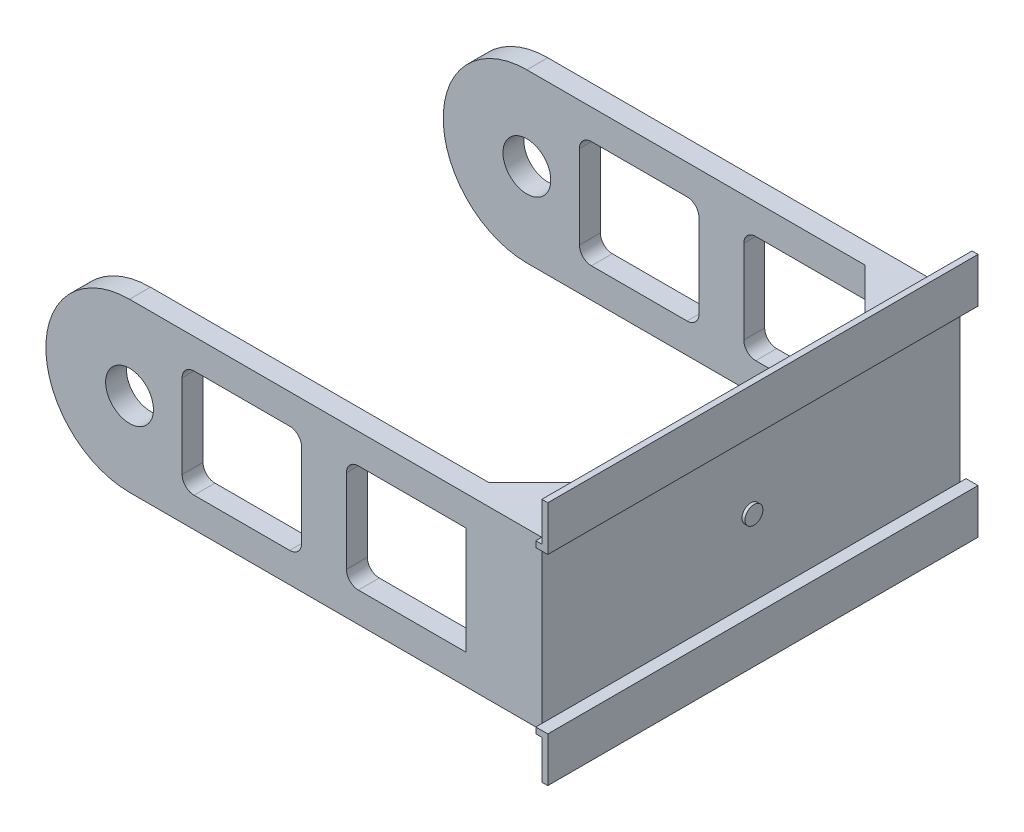
from build123d import *

# Parameters (mm, degrees)
SKETCH1_R           = 4
BOSS_EXTRUDE1_DEPTH = 35
SKETCH3_W           = 44.253465858
SKETCH3_H           = 32.381458222
CUT_EXTRUDE1_DEPTH  = 27.5
SKETCH4_W           = 83.940233782
SKETCH4_H           = 63
CUT_EXTRUDE2_DEPTH  = 68.149087857
CHAMFER1_SIZE       = 10
SKETCH7_W           = 20
SKETCH7_H           = 18
CUT_EXTRUDE3_DEPTH  = 88.155034278
FILLET2_R           = 2
BOSS_EXTRUDE4_START = 1
BOSS_EXTRUDE4_DEPTH = 72
SKETCH11_R          = 1.5
BOSS_EXTRUDE5_DEPTH = 0.5


with BuildPart() as part:
    # Sketch1 → Boss-Extrude1 (new, symmetric)
    with BuildSketch(Plane.XY):
        with BuildLine():
            Line((-36, 14), (33, 14))
            Line((33, 14), (33, -14))
            Line((33, -14), (-36, -14))
            ThreePointArc((-36, -14), (-50, 0), (-36, 14))
        make_face()
        with Locations((-36, 0)):
            Circle(SKETCH1_R, mode=Mode.SUBTRACT)
    extrude(amount=BOSS_EXTRUDE1_DEPTH, both=True)

    # Sketch3 → Cut-Extrude1 (cut, symmetric)
    with BuildSketch(Plane.XY):
        with Locations((-36, 0)):
            Rectangle(SKETCH3_W, SKETCH3_H)
    extrude(amount=CUT_EXTRUDE1_DEPTH, both=True, mode=Mode.SUBTRACT)

    # Sketch4 → Cut-Extrude2 (cut, through all)
    with BuildSketch(Plane(origin=(0, 14, 0), x_dir=(1, 0, 0), z_dir=(0, 1, 0))):
        with Locations((-11.375607931, 0)):
            Rectangle(SKETCH4_W, SKETCH4_H)
    extrude(amount=-CUT_EXTRUDE2_DEPTH, mode=Mode.SUBTRACT)

    # Chamfer1
    chamfer1_edges = [part.edges().sort_by_distance(p)[0] for p in [
        (30.59450896, 0, 31.5),
        (30.59450896, 0, -31.5),
    ]]
    chamfer(chamfer1_edges, length=CHAMFER1_SIZE)

    # Sketch7 → Cut-Extrude3 (cut, through all)
    with BuildSketch(Plane.XY.offset(35)):
        with Locations((-17.198958596, 0)):
            Rectangle(SKETCH7_W, SKETCH7_H)
        with Locations((10.301041404, 0)):
            Rectangle(SKETCH7_W, SKETCH7_H)
    extrude(amount=-CUT_EXTRUDE3_DEPTH, mode=Mode.SUBTRACT)

    # Fillet2
    # the kernel refuses this fillet: 2 mm, written as the material it adds along each edge
    with BuildSketch(Plane(origin=(-27.198958596, -9, -31.5), x_dir=(0, 1, 0), z_dir=(0, 0, -1)), Plane(origin=(-7.198958596, 9, -31.5), x_dir=(0, -1, 0), z_dir=(0, 0, -1)), Plane(origin=(-7.198958596, 9, 35), x_dir=(0, -1, 0), z_dir=(0, 0, -1)), Plane(origin=(-7.198958596, -9, -31.5), x_dir=(-1, 0, 0), z_dir=(0, 0, -1)), Plane(origin=(0.301041404, -9, -31.5), x_dir=(0, 1, 0), z_dir=(0, 0, -1))) as fillet2_piece_1:
        with BuildLine():
            CenterArc((FILLET2_R, FILLET2_R), FILLET2_R, 180, 90)
            Line((0, FILLET2_R), (0, 0))
            Line((0, 0), (FILLET2_R, 0))
        make_face()
    extrude(amount=3.5)
    with BuildSketch(Plane(origin=(-27.198958596, -9, 35), x_dir=(1, 0, 0), z_dir=(0, 0, -1)), Plane(origin=(-27.198958596, 9, -31.5), x_dir=(0, -1, 0), z_dir=(0, 0, -1)), Plane(origin=(-27.198958596, 9, 35), x_dir=(0, -1, 0), z_dir=(0, 0, -1)), Plane(origin=(-7.198958596, -9, 35), x_dir=(0, 1, 0), z_dir=(0, 0, -1)), Plane(origin=(0.301041404, -9, 35), x_dir=(1, 0, 0), z_dir=(0, 0, -1)), Plane(origin=(0.301041404, 9, -31.5), x_dir=(0, -1, 0), z_dir=(0, 0, -1)), Plane(origin=(0.301041404, 9, 35), x_dir=(0, -1, 0), z_dir=(0, 0, -1))) as fillet2_piece_2:
        with BuildLine():
            CenterArc((FILLET2_R, -FILLET2_R), FILLET2_R, 90, 90)
            Line((0, -FILLET2_R), (0, 0))
            Line((0, 0), (FILLET2_R, 0))
        make_face()
    extrude(amount=3.5)
    # the kernel refuses this fillet: 2 mm, written as the material it takes off along each edge
    with BuildSketch(Plane(origin=(20.301041404, 9, -31.5), x_dir=(1, 0, 0), z_dir=(0, -1, 0)), Plane(origin=(20.301041404, -9, 31.5), x_dir=(1, 0, 0), z_dir=(0, 1, 0))) as fillet2_2_piece_1:
        with BuildLine():
            CenterArc((2, -1.042951109), FILLET2_R, 148.568719088, 31.431280912)
            Line((0, -1.042951109), (0, 0))
            Line((0, 0), (0.293467555, 0))
        make_face()
    extrude(amount=18, mode=Mode.SUBTRACT)

    # Sketch10 → Boss-Extrude4 (add)
    with BuildSketch(Plane.XY.offset(35).offset(BOSS_EXTRUDE4_START)):
        Polygon((33, 14), (34, 14), (34, 20.5), (35, 20.5), (35, 13), (33, 13), align=None)
        Polygon((33, -14), (33, -13), (35, -13), (35, -20.5), (34, -20.5), (34, -14), align=None)
    extrude(amount=-BOSS_EXTRUDE4_DEPTH)

    # Sketch11 → Boss-Extrude5 (add)
    with BuildSketch(Plane(origin=(33, 0, 0), x_dir=(0, 0, -1), z_dir=(1, 0, 0))):
        with Locations(Location((0, 0, 0), (0, 0, 270))):
            Circle(SKETCH11_R)
    extrude(amount=BOSS_EXTRUDE5_DEPTH)


solid = part.part
